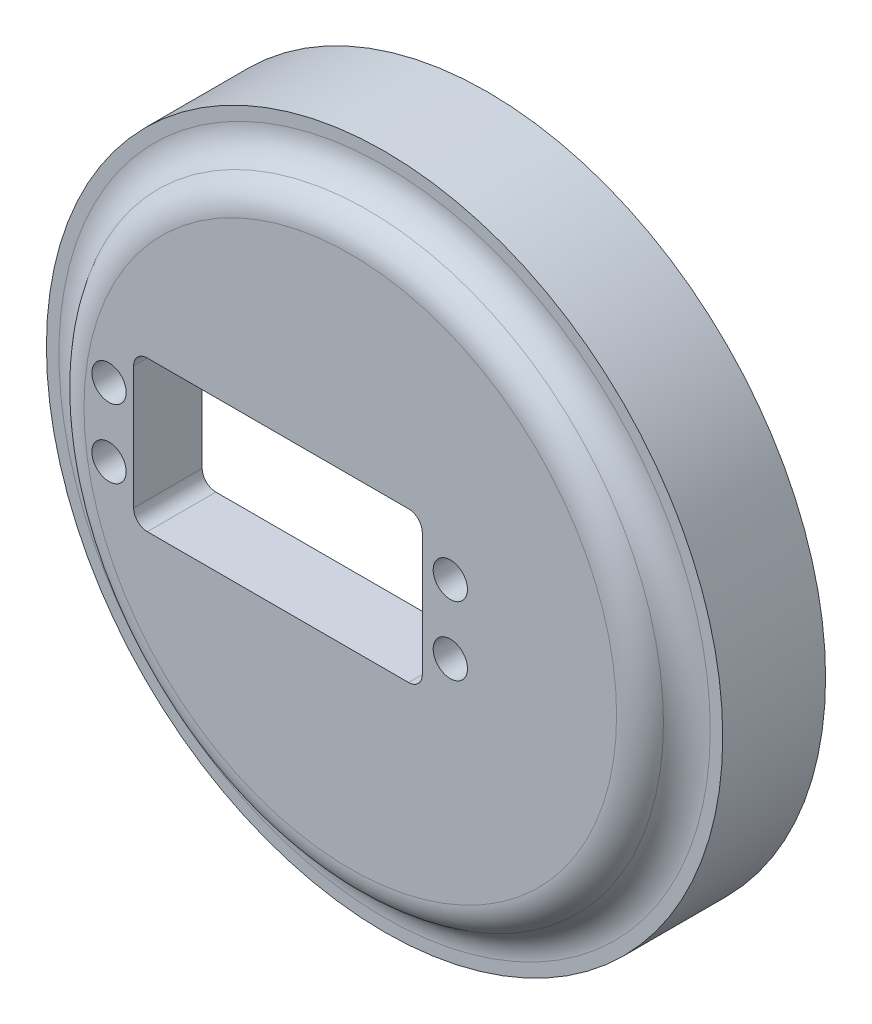
from build123d import *

# Parameters (mm, degrees)
SKETCH1_R           = 49.32
SKETCH1_R_2         = 46.32
EXTRUDE_THIN1_DEPTH = 10
SKETCH2_R           = 49.32
BOSS_EXTRUDE1_DEPTH = 5
SKETCH3_R           = 42.5
BOSS_EXTRUDE2_DEPTH = 5
FILLET1_R           = 5
FILLET2_R           = 5
SKETCH4_R           = 2.5
SKETCH4_W           = 42.1
SKETCH4_H           = 21.934824781
CUT_EXTRUDE1_DEPTH  = 73.559801543
FILLET3_R           = 2


with BuildPart() as part:
    # Sketch1 → Extrude-Thin1 (new body)
    with BuildSketch(Plane.XY):
        Circle(SKETCH1_R)
        Circle(SKETCH1_R_2, mode=Mode.SUBTRACT)
    extrude(amount=EXTRUDE_THIN1_DEPTH)

    # Sketch2 → Boss-Extrude1 (add)
    with BuildSketch(Plane.XY.offset(10)):
        Circle(SKETCH2_R)
    extrude(amount=BOSS_EXTRUDE1_DEPTH)

    # Sketch3 → Boss-Extrude2 (add)
    with BuildSketch(Plane.XY.offset(15)):
        Circle(SKETCH3_R)
    extrude(amount=BOSS_EXTRUDE2_DEPTH)

    # Fillet1
    fillet1_edges = [part.edges().sort_by_distance(p)[0] for p in [
        (-42.5, 0, 15),
        (-46.32, 0, 10),
    ]]
    fillet(fillet1_edges, radius=FILLET1_R - 0.0001)  # a hair under: the kernel refuses the full size

    # Fillet2
    fillet2_edges = [part.edges().sort_by_distance(p)[0] for p in [
        (-42.5, 0, 20),
    ]]
    fillet(fillet2_edges, radius=FILLET2_R)

    # Sketch4 → Cut-Extrude1 (cut, through all)
    with BuildSketch(Plane.XY.offset(20)):
        with Locations((-35.189613301, 5)):
            Circle(SKETCH4_R)
        with Locations((-35.189613301, -5)):
            Circle(SKETCH4_R)
        with Locations((14.589613301, 5)):
            Circle(SKETCH4_R)
        with Locations((14.589613301, -5)):
            Circle(SKETCH4_R)
        with Locations((-10.55, -0.067412391)):
            Rectangle(SKETCH4_W, SKETCH4_H)
    extrude(amount=-CUT_EXTRUDE1_DEPTH, mode=Mode.SUBTRACT)

    # Fillet3
    fillet3_edges = [part.edges().sort_by_distance(p)[0] for p in [
        (10.5, 10.9, 15),
        (10.5, -11.034824781, 15),
        (-31.6, -11.034824781, 15),
        (-31.6, 10.9, 15),
    ]]
    fillet(fillet3_edges, radius=FILLET3_R)


solid = part.part
